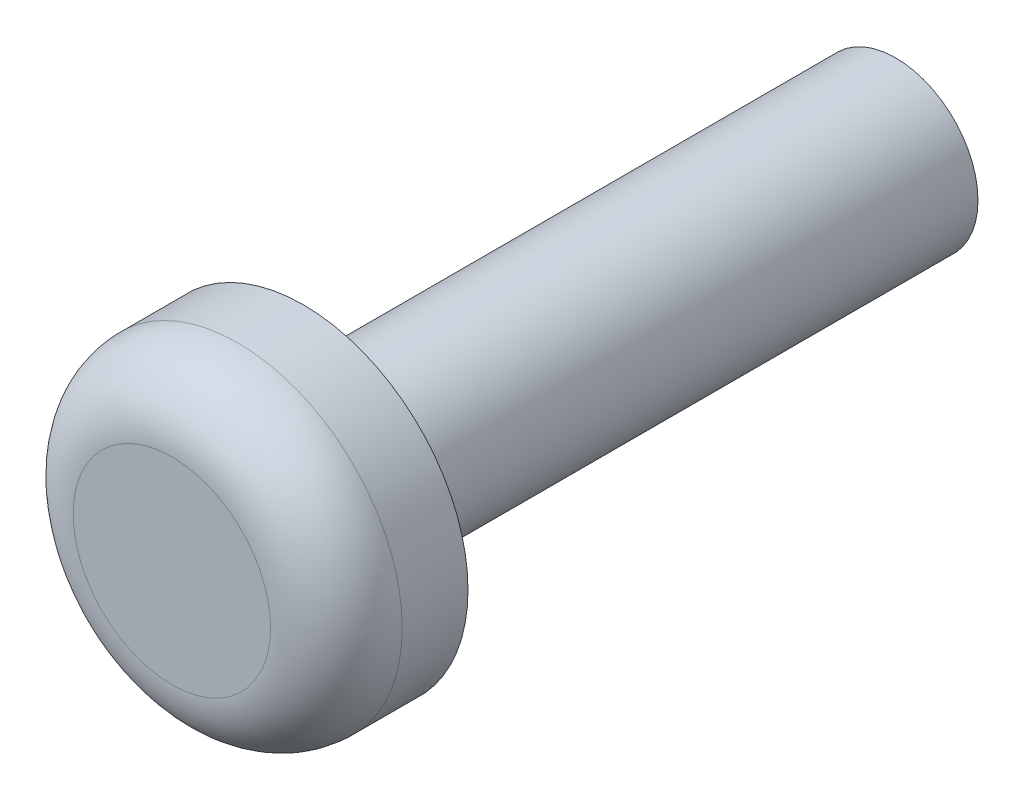
from build123d import *

# Parameters (mm, degrees)
SKETCH1_R           = 1.25
BOSS_EXTRUDE1_DEPTH = 9
SKETCH2_R           = 2.5
BOSS_EXTRUDE2_DEPTH = 2
FILLET1_R           = 1


with BuildPart() as part:
    # Sketch1 → Boss-Extrude1 (new body)
    with BuildSketch(Plane.XY):
        Circle(SKETCH1_R)
    extrude(amount=BOSS_EXTRUDE1_DEPTH)

    # Sketch2 → Boss-Extrude2 (add)
    with BuildSketch(Plane.XY.offset(9)):
        Circle(SKETCH2_R)
    extrude(amount=BOSS_EXTRUDE2_DEPTH)

    # Fillet1
    fillet1_edges = [part.edges().sort_by_distance(p)[0] for p in [
        (-2.5, 0, 11),
    ]]
    fillet(fillet1_edges, radius=FILLET1_R)


solid = part.part
